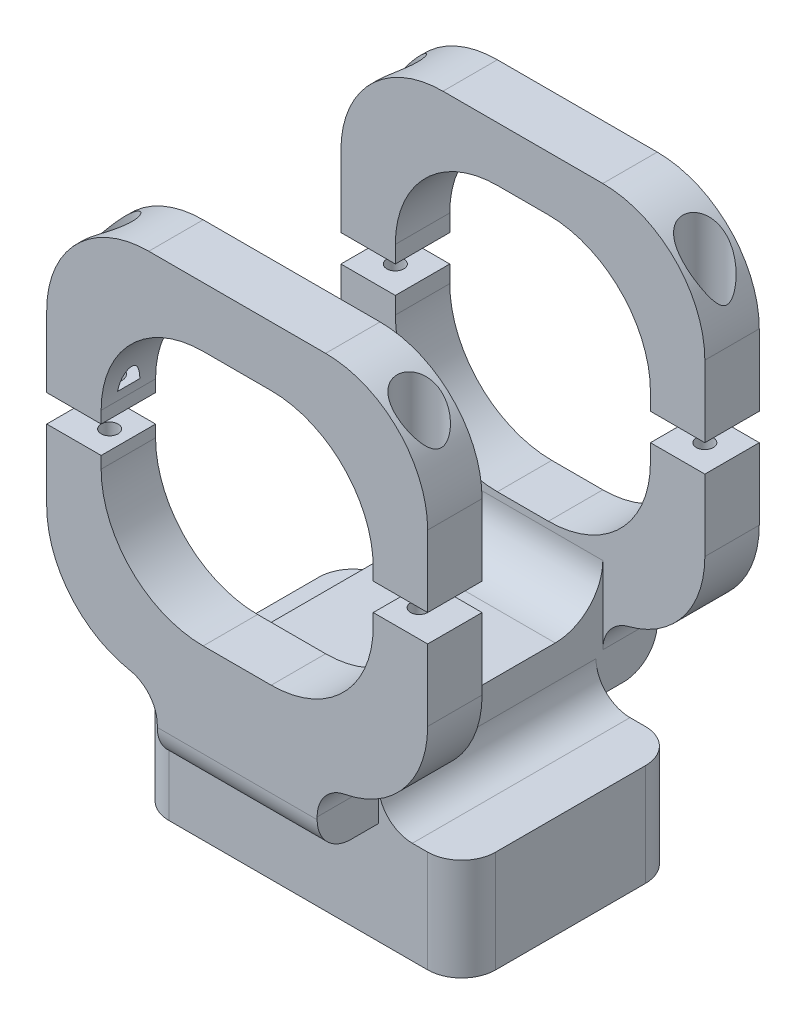
from build123d import *

# Parameters (mm, degrees)
SKETCH1_W                 = 53.5
SKETCH1_H                 = 55
SKETCH1_W_2               = 37.5
SKETCH1_H_2               = 39
BOSS_EXTRUDE1_DEPTH       = 8
FILLET1_R                 = 15
SKETCH2_W                 = 23.5
SKETCH2_H                 = 50
BOSS_EXTRUDE2_DEPTH       = 10
SKETCH3_W                 = 56
SKETCH3_H                 = 55
SKETCH3_W_2               = 40
SKETCH3_H_2               = 37.5
BOSS_EXTRUDE3_DEPTH       = 8
FILLET2_R                 = 15
FILLET3_R                 = 7
FILLET4_R                 = 5
SKETCH4_W                 = 48
SKETCH4_H                 = 32
BOSS_EXTRUDE4_DEPTH       = 15
FILLET5_R                 = 5
FILLET6_R                 = 5
F_2_5MM_DOWEL_HOLE1_D     = 2.5
F_2_5MM_DOWEL_HOLE1_DEPTH = 12
F_2_5MM_DOWEL_HOLE1_TIP   = 0.751075774
SKETCH8_W                 = 81.07629713
SKETCH8_H                 = 4
CUT_EXTRUDE1_DEPTH        = 78.719045285
CUT_EXTRUDE2_DEPTH        = 77.382262339
CUT_EXTRUDE2_DEPTH_BACK   = 12
SKETCH9_R                 = 1.25
SKETCH10_R                = 1.75
CUT_EXTRUDE3_DEPTH        = 80.083816395
SKETCH11_R                = 3.25
CUT_EXTRUDE4_DEPTH        = 22.5


with BuildPart() as part:
    # Sketch1 → Boss-Extrude1 (new body)
    with BuildSketch(Plane.XY):
        Rectangle(SKETCH1_W, SKETCH1_H)
        Rectangle(SKETCH1_W_2, SKETCH1_H_2, mode=Mode.SUBTRACT)
    extrude(amount=BOSS_EXTRUDE1_DEPTH)

    # Fillet1
    fillet1_edges = [part.edges().sort_by_distance(p)[0] for p in [
        (18.75, -19.5, 4),
        (18.75, 19.5, 4),
        (-18.75, 19.5, 4),
        (-18.75, -19.5, 4),
        (26.75, -27.5, 4),
        (-26.75, -27.5, 4),
        (-26.75, 27.5, 4),
        (26.75, 27.5, 4),
    ]]
    fillet(fillet1_edges, radius=FILLET1_R)

    # Sketch2 → Boss-Extrude2 (add)
    with BuildSketch(Plane.XZ.offset(27.5)):
        with Locations((0, 25)):
            Rectangle(SKETCH2_W, SKETCH2_H)
    extrude(amount=BOSS_EXTRUDE2_DEPTH)

    # Sketch3 → Boss-Extrude3 (add)
    with BuildSketch(Plane.XY.offset(50)):
        Rectangle(SKETCH3_W, SKETCH3_H)
        Rectangle(SKETCH3_W_2, SKETCH3_H_2, mode=Mode.SUBTRACT)
    extrude(amount=-BOSS_EXTRUDE3_DEPTH)

    # Fillet2
    fillet2_edges = [part.edges().sort_by_distance(p)[0] for p in [
        (28, -27.5, 46),
        (28, 27.5, 46),
        (-28, -27.5, 46),
        (-28, 27.5, 46),
        (20, -18.75, 46),
        (-20, -18.75, 46),
        (-20, 18.75, 46),
        (20, 18.75, 46),
    ]]
    fillet(fillet2_edges, radius=FILLET2_R)

    # Fillet3
    # the kernel refuses this fillet: 7 mm, written as the material it adds along each edge
    with BuildSketch(Plane(origin=(11.75, -27.5, 8), x_dir=(0, 0, 1), z_dir=(-1, 0, 0)), Plane(origin=(11.75, -27.5, 42), x_dir=(0, 1, 0), z_dir=(-1, 0, 0))) as fillet3_piece_1:
        with BuildLine():
            CenterArc((FILLET3_R, FILLET3_R), FILLET3_R, 180, 90)
            Line((0, FILLET3_R), (0, 0))
            Line((0, 0), (FILLET3_R, 0))
        make_face()
    extrude(amount=23.5)

    # Fillet4
    # the kernel refuses this fillet: 5 mm, written as the material it adds along each edge
    with BuildSketch(Plane(origin=(11.75, -27.5, 0), x_dir=(0, -1, 0), z_dir=(0, 0, 1))) as fillet4_piece_1:
        with BuildLine():
            CenterArc((4.364916731, 5), FILLET4_R, 194.477512186, 75.522487814)
            ThreePointArc((-0.476312452, 3.75), (-0.119554556, 1.890064387), (0, 0))
            Line((0, 0), (4.364916731, 0))
        make_face()
    extrude(amount=8)
    with BuildSketch(Plane(origin=(11.75, -27.5, 42), x_dir=(0, -1, 0), z_dir=(0, 0, 1)), Plane(origin=(-11.75, -27.5, 50), x_dir=(0, -1, 0), z_dir=(0, 0, -1))) as fillet4_piece_2:
        with BuildLine():
            CenterArc((4.645292057, 5), FILLET4_R, 190.806922875, 79.193077125)
            Line((-0.266030957, 4.0625), (-0.757163259, 3.96875))
            ThreePointArc((-0.757163259, 3.96875), (-0.5, 1.25), (-0.5, 0))
            Line((-0.5, 0), (0, -0.5))
            Line((0, -0.5), (4.645292057, -0.5))
            Line((4.645292057, -0.5), (4.645292057, 0))
        make_face()
    extrude(amount=8)
    with BuildSketch(Plane(origin=(-11.75, -27.5, 0), x_dir=(0, -1, 0), z_dir=(0, 0, 1))) as fillet4_piece_3:
        with BuildLine():
            CenterArc((4.364916731, -5), FILLET4_R, 90, 75.522487814)
            ThreePointArc((-0.476312452, -3.75), (-0.119554556, -1.890064387), (0, 0))
            Line((0, 0), (4.364916731, 0))
        make_face()
    extrude(amount=8)

    # Sketch4 → Boss-Extrude4 (add)
    with BuildSketch(Plane.XZ.offset(37.5)):
        with Locations((0, 25)):
            Rectangle(SKETCH4_W, SKETCH4_H)
    extrude(amount=BOSS_EXTRUDE4_DEPTH)

    # Fillet5
    fillet5_edges = [part.edges().sort_by_distance(p)[0] for p in [
        (24, -45, 9),
        (24, -45, 41),
        (-24, -45, 41),
        (-24, -45, 9),
    ]]
    fillet(fillet5_edges, radius=FILLET5_R)

    # Fillet6
    fillet6_edges = [part.edges().sort_by_distance(p)[0] for p in [
        (-11.75, -37.5, 25),
        (11.75, -37.5, 25),
        (0, -37.5, 0),
        (0, -37.5, 50),
    ]]
    fillet(fillet6_edges, radius=FILLET6_R)

    # Ø2.5mm Dowel Hole1
    with Locations(Plane(origin=(0, -52.5, 0), x_dir=(-1, 0, 0), z_dir=(0, -1, 0))):
        with Locations((-14, -25), (14, -25), (21, -25), (-21, -25)):
            Hole(F_2_5MM_DOWEL_HOLE1_D / 2, depth=F_2_5MM_DOWEL_HOLE1_DEPTH)
            with Locations((0, 0, -(F_2_5MM_DOWEL_HOLE1_DEPTH + F_2_5MM_DOWEL_HOLE1_TIP / 2))):  # 118° drill point
                Cone(0, F_2_5MM_DOWEL_HOLE1_D / 2, F_2_5MM_DOWEL_HOLE1_TIP, mode=Mode.SUBTRACT)

    # Sketch8 → Cut-Extrude1 (cut, through all)
    with BuildSketch(Plane(origin=(0, 0, 0), x_dir=(-1, 0, 0), z_dir=(0, 0, -1))):
        Rectangle(SKETCH8_W, SKETCH8_H)
    extrude(amount=-CUT_EXTRUDE1_DEPTH, mode=Mode.SUBTRACT)


with BuildPart() as cut_extrude1_piece_1:
    # of the separate pieces the step leaves, piece 1, a body of its own (cut_extrude1_pieces)
    add(part.part.solids().sort_by_distance((-16.75, -37.5, 9))[0])


with BuildPart() as cut_extrude1_piece_2:
    # of the separate pieces the step leaves, piece 2, a body of its own (cut_extrude1_pieces)
    add(part.part.solids().sort_by_distance((28, 12.5, 50))[0])


with BuildPart() as cut_extrude1_piece_3:
    # of the separate pieces the step leaves, piece 3, a body of its own (cut_extrude1_pieces)
    add(part.part.solids().sort_by_distance((-18.75, 2, 8))[0])


with BuildPart() as cut_extrude2_tool:
    # Sketch9 → Cut-Extrude2 (new, two sides: drawn at the far end of the back side and taken through both)
    with BuildSketch(Plane(origin=(0, -2, 0), x_dir=(1, 0, 0), z_dir=(0, 1, 0)).offset(-CUT_EXTRUDE2_DEPTH_BACK)):
        with Locations(Location((-22.75, -4, 0), (0, 0, 90))):
            Circle(SKETCH9_R)
        with Locations(Location((22.75, -4, 0), (0, 0, 90))):
            Circle(SKETCH9_R)
        with Locations(Location((-22.75, -46, 0), (0, 0, 90))):
            Circle(SKETCH9_R)
        with Locations(Location((22.75, -46, 0), (0, 0, 90))):
            Circle(SKETCH9_R)
    extrude(amount=CUT_EXTRUDE2_DEPTH + CUT_EXTRUDE2_DEPTH_BACK)


with BuildPart() as cut_extrude1_piece_1_1:
    add(cut_extrude1_piece_1.part)

    # Cut-Extrude2: cut by cut_extrude2_tool
    add(cut_extrude2_tool.part, mode=Mode.SUBTRACT)


with BuildPart() as cut_extrude1_piece_2_1:
    add(cut_extrude1_piece_2.part)

    # Cut-Extrude2: cut by cut_extrude2_tool
    add(cut_extrude2_tool.part, mode=Mode.SUBTRACT)


with BuildPart() as cut_extrude1_piece_3_1:
    add(cut_extrude1_piece_3.part)

    # Cut-Extrude2: cut by cut_extrude2_tool
    add(cut_extrude2_tool.part, mode=Mode.SUBTRACT)


with BuildPart() as cut_extrude3_tool:
    # Sketch10 → Cut-Extrude3 (new, through all)
    with BuildSketch(Plane.XZ.offset(-2)):
        with Locations(Location((-22.75, 46, 0), (0, 0, 270))):
            Circle(SKETCH10_R)
        with Locations(Location((22.75, 46, 0), (0, 0, 270))):
            Circle(SKETCH10_R)
        with Locations(Location((22.75, 4, 0), (0, 0, 270))):
            Circle(SKETCH10_R)
        with Locations(Location((-22.75, 4, 0), (0, 0, 270))):
            Circle(SKETCH10_R)
    extrude(amount=-CUT_EXTRUDE3_DEPTH)


with BuildPart() as cut_extrude1_piece_2_2:
    add(cut_extrude1_piece_2_1.part)

    # Cut-Extrude3: cut by cut_extrude3_tool
    add(cut_extrude3_tool.part, mode=Mode.SUBTRACT)


with BuildPart() as cut_extrude1_piece_3_2:
    add(cut_extrude1_piece_3_1.part)

    # Cut-Extrude3: cut by cut_extrude3_tool
    add(cut_extrude3_tool.part, mode=Mode.SUBTRACT)


with BuildPart() as cut_extrude4_tool:
    # Sketch11 → Cut-Extrude4 (new body)
    with BuildSketch(Plane(origin=(0, 27.5, 0), x_dir=(1, 0, 0), z_dir=(0, 1, 0))):
        with Locations(Location((-22.75, -4, 0), (0, 0, 270))):
            Circle(SKETCH11_R)
        with Locations(Location((22.75, -4, 0), (0, 0, 270))):
            Circle(SKETCH11_R)
        with Locations(Location((22.75, -46, 0), (0, 0, 270))):
            Circle(SKETCH11_R)
        with Locations(Location((-22.75, -46, 0), (0, 0, 270))):
            Circle(SKETCH11_R)
    extrude(amount=-CUT_EXTRUDE4_DEPTH)


with BuildPart() as cut_extrude1_piece_2_3:
    add(cut_extrude1_piece_2_2.part)

    # Cut-Extrude4: cut by cut_extrude4_tool
    add(cut_extrude4_tool.part, mode=Mode.SUBTRACT)


with BuildPart() as cut_extrude1_piece_3_3:
    add(cut_extrude1_piece_3_2.part)

    # Cut-Extrude4: cut by cut_extrude4_tool
    add(cut_extrude4_tool.part, mode=Mode.SUBTRACT)


solid = Compound([cut_extrude1_piece_1_1.part, cut_extrude1_piece_2_3.part, cut_extrude1_piece_3_3.part])
